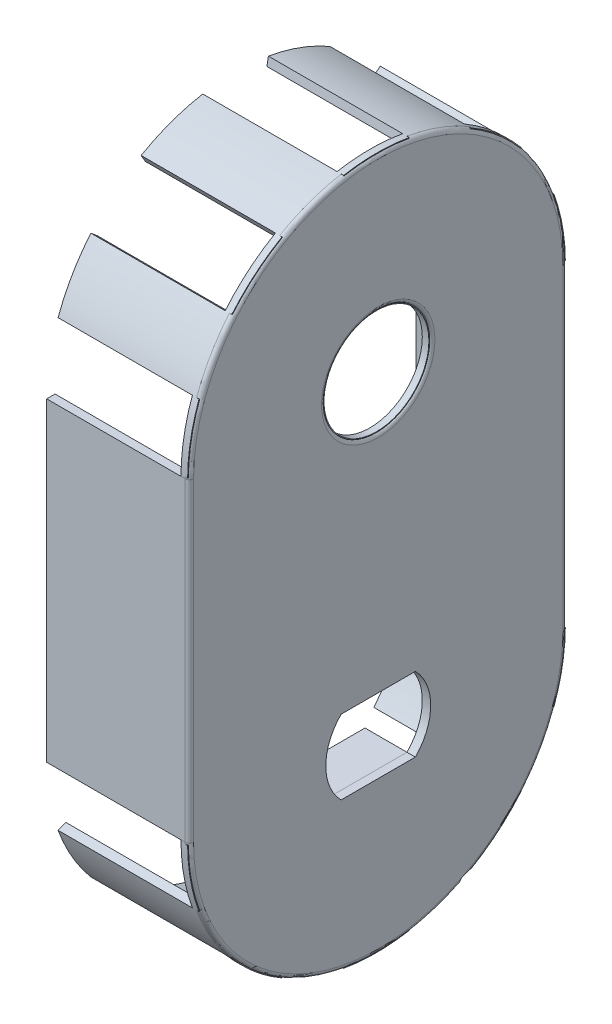
from build123d import *
from build123d.topology import SkipClean

# Parameters (mm, degrees)
SKETCH2_R                  = 3.175
BOSS_EXTRUDE1_DEPTH        = 0.254
FILLET1_R                  = 0.254
SKETCH3_W                  = 0.508
SKETCH3_H                  = 19.05
BOSS_EXTRUDE2_DEPTH        = 8.128
CONVERT_SOLID1_START       = -9.425000009
CONVERT_SOLID1_DEPTH       = 15.774999909
CONVERT_SOLID1_START_2     = -13.434290238
CONVERT_SOLID1_2_OUTLINE_W = 0.399999962
CONVERT_SOLID1_2_OUTLINE_H = 20.243999898
CONVERT_SOLID1_2_DEPTH     = 4.009290229
CONVERT_SOLID1_3_DEPTH     = 18.850000018
CONVERT_SOLID1_START_3     = 12.7000001
CONVERT_SOLID1_4_OUTLINE_W = 0.399999962
CONVERT_SOLID1_4_OUTLINE_H = 20.243999898
CONVERT_SOLID1_4_DEPTH     = 0.734290138
CONVERT_SOLID1_START_4     = -9.525
CONVERT_SOLID1_5_OUTLINE_W = 7.327999949
CONVERT_SOLID1_5_OUTLINE_H = 0.399999962
CONVERT_SOLID1_5_DEPTH     = 19.05
CONVERT_SOLID1_START_5     = -0.254
CONVERT_SOLID1_6_OUTLINE_R = 3.175
CONVERT_SOLID1_6_DEPTH     = 0.399999962
SKETCH3_3_W                = 4.49012806
SKETCH3_3_H                = 0.508
BOSS_EXTRUDE3_DEPTH        = 2.54
CUT_EXTRUDE1_DEPTH         = 26.215497443
CUT_EXTRUDE1_DEPTH_BACK    = 26.215497443


with BuildPart() as part:
    # Sketch2 → Boss-Extrude1 (new, symmetric)
    with BuildSketch(Plane(origin=(0, 0, 0), x_dir=(0, 0, -1), z_dir=(1, 0, 0))):
        with BuildLine():
            Line((11.43, 9.525), (11.43, -9.525))
            ThreePointArc((11.43, -9.525), (0, -20.955), (-11.43, -9.525))
            Line((-11.43, -9.525), (-11.43, 9.525))
            ThreePointArc((-11.43, 9.525), (0, 20.955), (11.43, 9.525))
        make_face()
        with Locations((0, 9.525)):
            Circle(SKETCH2_R, mode=Mode.SUBTRACT)
    extrude(amount=BOSS_EXTRUDE1_DEPTH, both=True)

    # Fillet1
    fillet1_edges = [part.edges().sort_by_distance(p)[0] for p in [
        (0.254, -20.955, 0),
        (0.254, 9.525, 3.175),
        (0.254, 0, -11.43),
        (0.254, 20.955, 0),
        (0.254, 0, 11.43),
    ]]
    fillet(fillet1_edges, radius=FILLET1_R)

    # Sketch3 → Boss-Extrude2 (add)
    with BuildSketch(Plane.ZY.offset(0.254)):
        with Locations((-11.176, 0)):
            Rectangle(SKETCH3_W, SKETCH3_H)
        with BuildLine():
            Line((-10.740686656, 13.434290238), (-10.263322804, 13.260544005))
            ThreePointArc((-10.263322804, 13.260544005), (-9.45872946, 14.986), (-8.366737408, 16.545526273))
            Line((-8.366737408, 16.545526273), (-8.755887985, 16.872062379))
            ThreePointArc((-8.755887985, 16.872062379), (-9.898670365, 15.24), (-10.740686656, 13.434290238))
        make_face()
        with BuildLine():
            Line((-5.715, 19.423670365), (-5.461, 18.98372946))
            ThreePointArc((-5.461, 18.98372946), (-3.735544005, 19.788322804), (-1.896585396, 20.281070278))
            Line((-1.896585396, 20.281070278), (-1.984798671, 20.781352617))
            ThreePointArc((-1.984798671, 20.781352617), (-3.909290238, 20.265686656), (-5.715, 19.423670365))
        make_face()
        with BuildLine():
            Line((1.984798671, 20.781352617), (1.896585396, 20.281070278))
            ThreePointArc((1.896585396, 20.281070278), (3.735544005, 19.788322804), (5.461, 18.98372946))
            Line((5.461, 18.98372946), (5.715, 19.423670365))
            ThreePointArc((5.715, 19.423670365), (3.909290238, 20.265686656), (1.984798671, 20.781352617))
        make_face()
        with BuildLine():
            ThreePointArc((8.366737408, 16.545526273), (9.45872946, 14.986), (10.263322804, 13.260544005))
            Line((10.263322804, 13.260544005), (10.740686656, 13.434290238))
            ThreePointArc((10.740686656, 13.434290238), (9.898670365, 15.24), (8.755887985, 16.872062379))
            Line((8.755887985, 16.872062379), (8.366737408, 16.545526273))
        make_face()
        with Locations((11.176, 0)):
            Rectangle(SKETCH3_W, SKETCH3_H)
    boss_extrude2 = extrude(amount=BOSS_EXTRUDE2_DEPTH)

    # Mirror1: Boss-Extrude2 across plane
    with SkipClean():  # the faces are left unmerged after this step: merging them gives an invalid solid
        add(boss_extrude2.mirror(Plane.ZX))



with BuildPart() as body_2:
    # Convert-Solid1: read off the stored shape, not the designer's step
    # Convert-Solid1 outline → Convert-Solid1 (new body)
    with BuildSketch(Plane(origin=(0, 0, 0), x_dir=(1, 0, 0), z_dir=(0, 1, 0)).offset(CONVERT_SOLID1_START)):
        with BuildLine():
            Line((0.145999962, -10.721999892), (0.145999962, 10.721999892))
            ThreePointArc((0.145999962, 10.721999892), (-0.02973599, 11.14626401), (-0.454000108, 11.321999962))
            Line((-0.454000108, 11.321999962), (-8.382, 11.321999962))
            Line((-8.382, 11.321999962), (-8.382, 10.922))
            Line((-8.382, 10.922), (-0.454000108, 10.922))
            ThreePointArc((-0.454000108, 10.922), (-0.312578675, 10.863421325), (-0.254, 10.721999892))
            Line((-0.254, 10.721999892), (-0.254, -10.721999892))
            ThreePointArc((-0.254, -10.721999892), (-0.312578675, -10.863421325), (-0.454000108, -10.922))
            Line((-0.454000108, -10.922), (-8.382, -10.922))
            Line((-8.382, -10.922), (-8.382, -11.321999962))
            Line((-8.382, -11.321999962), (-0.454000108, -11.321999962))
            ThreePointArc((-0.454000108, -11.321999962), (-0.02973599, -11.14626401), (0.145999962, -10.721999892))
        make_face()
    extrude(amount=CONVERT_SOLID1_DEPTH)

    # Convert-Solid1 2 outline → Convert-Solid1 2 (add)
    with BuildSketch(Plane(origin=(0, 0, 0), x_dir=(1, 0, 0), z_dir=(0, 1, 0)).offset(CONVERT_SOLID1_START_2)):
        with Locations((-0.054000019, 0)):
            Rectangle(CONVERT_SOLID1_2_OUTLINE_W, CONVERT_SOLID1_2_OUTLINE_H)
    extrude(amount=CONVERT_SOLID1_2_DEPTH)

    # Convert-Solid1 3 outline → Convert-Solid1 3 (add)
    with BuildSketch(Plane(origin=(0, 0, 0), x_dir=(1, 0, 0), z_dir=(0, 1, 0)).offset(CONVERT_SOLID1_START)):
        with BuildLine():
            Line((0.145999962, -10.721999892), (0.145999962, -10.121999949))
            Line((0.145999962, -10.121999949), (-0.254, -10.121999949))
            Line((-0.254, -10.121999949), (-0.254, -10.721999892))
            ThreePointArc((-0.254, -10.721999892), (-0.312578675, -10.863421325), (-0.454000108, -10.922))
            Line((-0.454000108, -10.922), (-8.382, -10.922))
            Line((-8.382, -10.922), (-8.382, -11.321999962))
            Line((-8.382, -11.321999962), (-0.454000108, -11.321999962))
            ThreePointArc((-0.454000108, -11.321999962), (-0.02973599, -11.14626401), (0.145999962, -10.721999892))
        make_face()
        with BuildLine():
            Line((-0.254, 10.121999949), (0.145999962, 10.121999949))
            Line((0.145999962, 10.121999949), (0.145999962, 10.721999892))
            ThreePointArc((0.145999962, 10.721999892), (-0.02973599, 11.14626401), (-0.454000108, 11.321999962))
            Line((-0.454000108, 11.321999962), (-8.382, 11.321999962))
            Line((-8.382, 11.321999962), (-8.382, 10.922))
            Line((-8.382, 10.922), (-0.454000108, 10.922))
            ThreePointArc((-0.454000108, 10.922), (-0.312578675, 10.863421325), (-0.254, 10.721999892))
            Line((-0.254, 10.721999892), (-0.254, 10.121999949))
        make_face()
    extrude(amount=CONVERT_SOLID1_3_DEPTH)

    # Convert-Solid1 4 outline → Convert-Solid1 4 (add)
    with BuildSketch(Plane(origin=(0, 0, 0), x_dir=(1, 0, 0), z_dir=(0, 1, 0)).offset(CONVERT_SOLID1_START_3)):
        with Locations((-0.054000019, 0)):
            Rectangle(CONVERT_SOLID1_4_OUTLINE_W, CONVERT_SOLID1_4_OUTLINE_H)
    extrude(amount=CONVERT_SOLID1_4_DEPTH)

    # Convert-Solid1 5 outline → Convert-Solid1 5 (add)
    with BuildSketch(Plane(origin=(0, 0, 0), x_dir=(1, 0, 0), z_dir=(0, 1, 0)).offset(CONVERT_SOLID1_START_4)):
        with Locations((-4.718000026, -11.121999981)):
            Rectangle(CONVERT_SOLID1_5_OUTLINE_W, CONVERT_SOLID1_5_OUTLINE_H)
        with Locations((-4.718000026, 11.121999981)):
            Rectangle(CONVERT_SOLID1_5_OUTLINE_W, CONVERT_SOLID1_5_OUTLINE_H)
    extrude(amount=CONVERT_SOLID1_5_DEPTH)

    # Convert-Solid1 6 outline → Convert-Solid1 6 (add)
    with BuildSketch(Plane.YZ.offset(CONVERT_SOLID1_START_5)):
        with BuildLine():
            Line((-9.425000009, 10.721999892), (-9.425000009, 10.121999949))
            Line((-9.425000009, 10.121999949), (-9.62499999, 10.121999949))
            Line((-9.62499999, 10.121999949), (-9.624999991, 11.429562546))
            ThreePointArc((-9.624999991, 11.429562546), (-11.559020534, 11.247562423), (-13.434290238, 10.740686656))
            Line((-13.434290238, 10.740686656), (-13.260544005, 10.263322804))
            ThreePointArc((-13.260544005, 10.263322804), (-14.986, 9.45872946), (-16.545526273, 8.366737408))
            Line((-16.545526273, 8.366737408), (-16.872062379, 8.755887985))
            ThreePointArc((-16.872062379, 8.755887985), (-18.280887985, 7.347062379), (-19.423670365, 5.715))
            Line((-19.423670365, 5.715), (-18.98372946, 5.461))
            ThreePointArc((-18.98372946, 5.461), (-19.788322804, 3.735544005), (-20.281070278, 1.896585396))
            Line((-20.281070278, 1.896585396), (-20.781352617, 1.984798671))
            ThreePointArc((-20.781352617, 1.984798671), (-20.955, 0), (-20.781352617, -1.984798671))
            Line((-20.781352617, -1.984798671), (-20.281070278, -1.896585396))
            ThreePointArc((-20.281070278, -1.896585396), (-19.788322804, -3.735544005), (-18.98372946, -5.461))
            Line((-18.98372946, -5.461), (-19.423670365, -5.715))
            ThreePointArc((-19.423670365, -5.715), (-18.280887985, -7.347062379), (-16.872062379, -8.755887985))
            Line((-16.872062379, -8.755887985), (-16.545526273, -8.366737408))
            ThreePointArc((-16.545526273, -8.366737408), (-14.986, -9.45872946), (-13.260544005, -10.263322804))
            Line((-13.260544005, -10.263322804), (-13.434290238, -10.740686656))
            ThreePointArc((-13.434290238, -10.740686656), (-11.559020534, -11.247562423), (-9.62499999, -11.429562546))
            Line((-9.62499999, -11.429562546), (-9.62499999, -10.121999949))
            Line((-9.62499999, -10.121999949), (-9.42500001, -10.121999949))
            Line((-9.42500001, -10.121999949), (-9.425000009, -10.721999892))
            Line((-9.425000009, -10.721999892), (9.425000009, -10.721999892))
            Line((9.425000009, -10.721999892), (9.425000009, -10.121999949))
            Line((9.425000009, -10.121999949), (9.62499999, -10.121999949))
            Line((9.62499999, -10.121999949), (9.62499999, -11.429562546))
            ThreePointArc((9.62499999, -11.429562546), (11.559020534, -11.247562423), (13.434290238, -10.740686656))
            Line((13.434290238, -10.740686656), (13.260544005, -10.263322804))
            ThreePointArc((13.260544005, -10.263322804), (14.986, -9.45872946), (16.545526273, -8.366737408))
            Line((16.545526273, -8.366737408), (16.872062379, -8.755887985))
            ThreePointArc((16.872062379, -8.755887985), (18.280887985, -7.347062379), (19.423670365, -5.715))
            Line((19.423670365, -5.715), (18.98372946, -5.461))
            ThreePointArc((18.98372946, -5.461), (19.788322804, -3.735544005), (20.281070278, -1.896585396))
            Line((20.281070278, -1.896585396), (20.781352617, -1.984798671))
            ThreePointArc((20.781352617, -1.984798671), (20.955, 0), (20.781352617, 1.984798671))
            Line((20.781352617, 1.984798671), (20.281070278, 1.896585396))
            ThreePointArc((20.281070278, 1.896585396), (19.788322804, 3.735544005), (18.98372946, 5.461))
            Line((18.98372946, 5.461), (19.423670365, 5.715))
            ThreePointArc((19.423670365, 5.715), (18.280887985, 7.347062379), (16.872062379, 8.755887985))
            Line((16.872062379, 8.755887985), (16.545526273, 8.366737408))
            ThreePointArc((16.545526273, 8.366737408), (14.986, 9.45872946), (13.260544005, 10.263322804))
            Line((13.260544005, 10.263322804), (13.434290238, 10.740686656))
            ThreePointArc((13.434290238, 10.740686656), (11.559020534, 11.247562423), (9.624999991, 11.429562546))
            Line((9.624999991, 11.429562546), (9.62499999, 10.121999949))
            Line((9.62499999, 10.121999949), (9.425000009, 10.121999949))
            Line((9.425000009, 10.121999949), (9.425000009, 10.721999892))
            Line((9.425000009, 10.721999892), (-9.425000009, 10.721999892))
        make_face()
        with Locations((9.525, 0)):
            Circle(CONVERT_SOLID1_6_OUTLINE_R, mode=Mode.SUBTRACT)
    extrude(amount=CONVERT_SOLID1_6_DEPTH)


with BuildPart() as part_1:
    with SkipClean():  # the faces are left unmerged after this step: merging them gives an invalid solid
        add(part.part)

        add(body_2.part)  # Boss-Extrude3 merges body 2
        # Sketch3<3> → Boss-Extrude3 (add)
        with BuildSketch(Plane.ZY.offset(0.254)):
            with Locations((0, -12.02406403)):
                Rectangle(SKETCH3_3_W, SKETCH3_3_H)
            with Locations((0, -7.02593597)):
                Rectangle(SKETCH3_3_W, SKETCH3_3_H)
        extrude(amount=BOSS_EXTRUDE3_DEPTH)

    # Sketch3<4> → Cut-Extrude1 (cut, two sides: drawn at the far end of the back side and taken through both)
    with BuildSketch(Plane.ZY.offset(0.254).offset(-CUT_EXTRUDE1_DEPTH_BACK)):
        with BuildLine():
            Line((-2.24506403, -7.27993597), (2.24506403, -7.27993597))
            ThreePointArc((2.24506403, -7.27993597), (3.175, -9.525), (2.24506403, -11.77006403))
            Line((2.24506403, -11.77006403), (-2.24506403, -11.77006403))
            ThreePointArc((-2.24506403, -11.77006403), (-3.175, -9.525), (-2.24506403, -7.27993597))
        make_face()
    extrude(amount=CUT_EXTRUDE1_DEPTH + CUT_EXTRUDE1_DEPTH_BACK, mode=Mode.SUBTRACT)


solid = part_1.part
